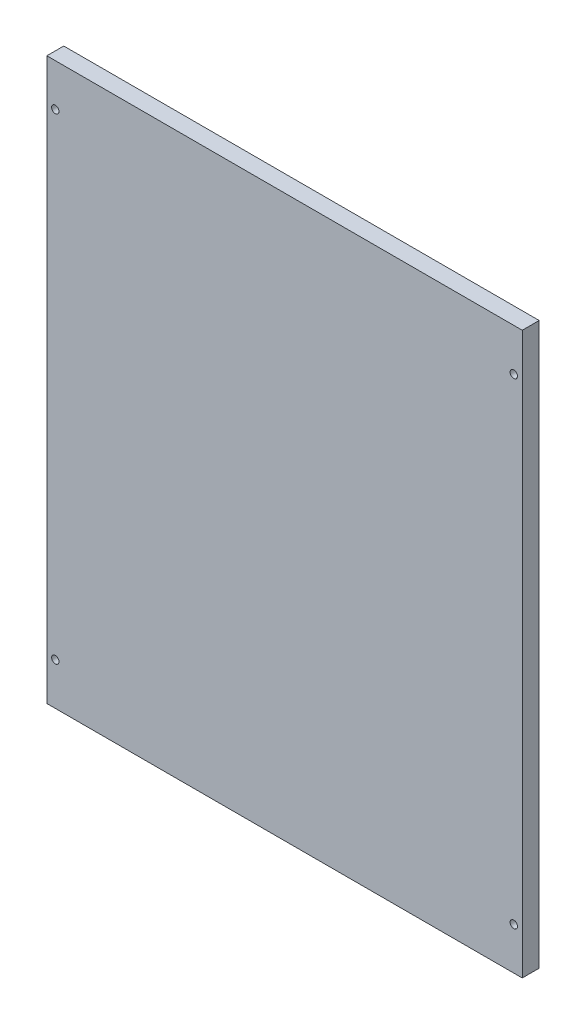
from build123d import *

# Parameters (mm, degrees)
SKETCH_1_W          = 450
SKETCH_1_H          = 531
EXTRUDE_5906_DEPTH  = 16
SKETCH_3_R          = 3.5
CUT_EXTRUDE_1_DEPTH = 16
SKETCH_4_R          = 3.5
CUT_EXTRUDE_2_DEPTH = 16
SKETCH_5_R          = 3.5
CUT_EXTRUDE_3_DEPTH = 16
SKETCH_6_R          = 3.5
CUT_EXTRUDE_4_DEPTH = 16


with BuildPart() as part:
    # Эскиз1 → Extrude 5906 (new body)
    with BuildSketch(Plane.XY):
        with Locations((225, 265.5)):
            Rectangle(SKETCH_1_W, SKETCH_1_H)
    extrude(amount=EXTRUDE_5906_DEPTH)

    # Эскиз3 → Cut-Extrude 1 (cut)
    with BuildSketch(Plane.XY.offset(16)):
        with Locations((8, 40)):
            Circle(SKETCH_3_R)
    extrude(amount=-CUT_EXTRUDE_1_DEPTH, mode=Mode.SUBTRACT)

    # Эскиз4 → Cut-Extrude 2 (cut)
    with BuildSketch(Plane.XY.offset(16)):
        with Locations((8, 491)):
            Circle(SKETCH_4_R)
    extrude(amount=-CUT_EXTRUDE_2_DEPTH, mode=Mode.SUBTRACT)

    # Эскиз5 → Cut-Extrude 3 (cut)
    with BuildSketch(Plane.XY.offset(16)):
        with Locations((442, 40)):
            Circle(SKETCH_5_R)
    extrude(amount=-CUT_EXTRUDE_3_DEPTH, mode=Mode.SUBTRACT)

    # Эскиз6 → Cut-Extrude 4 (cut)
    with BuildSketch(Plane.XY.offset(16)):
        with Locations((442, 491)):
            Circle(SKETCH_6_R)
    extrude(amount=-CUT_EXTRUDE_4_DEPTH, mode=Mode.SUBTRACT)


solid = part.part
